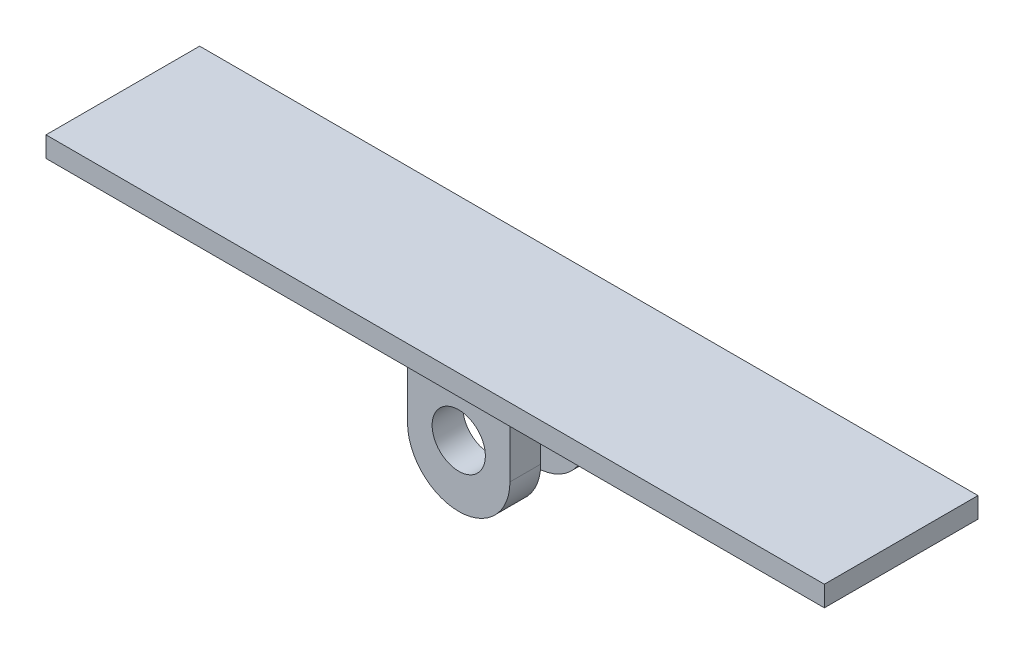
from build123d import *

# Parameters (mm, degrees)
SKETCH1_W           = 2
SKETCH1_H           = 76
BOSS_EXTRUDE1_DEPTH = 15
SKETCH2_W           = 10
SKETCH2_H           = 3
BOSS_EXTRUDE2_DEPTH = 12
SKETCH3_R           = 2.6
CUT_EXTRUDE1_DEPTH  = 12
FILLET1_R           = 5
SCALE1_SCALE        = 0.7


with BuildPart() as part:
    # Sketch1 → Boss-Extrude1 (new body)
    with BuildSketch(Plane(origin=(0, 0, 0), x_dir=(0, 1, 0), z_dir=(0, 0, 1))):
        Rectangle(SKETCH1_W, SKETCH1_H)
    extrude(amount=-BOSS_EXTRUDE1_DEPTH)

    # Sketch2 → Boss-Extrude2 (add)
    with BuildSketch(Plane.XZ.offset(1)):
        with Locations((0, -3.8)):
            Rectangle(SKETCH2_W, SKETCH2_H)
        with Locations((0, -11.3)):
            Rectangle(SKETCH2_W, SKETCH2_H)
    extrude(amount=BOSS_EXTRUDE2_DEPTH)

    # Sketch3 → Cut-Extrude1 (cut)
    with BuildSketch(Plane.XY.offset(-2.3)):
        with Locations((0, -7)):
            Circle(SKETCH3_R)
    extrude(amount=-CUT_EXTRUDE1_DEPTH, mode=Mode.SUBTRACT)

    # Fillet1
    fillet1_edges = [part.edges().sort_by_distance(p)[0] for p in [
        (-5, -13, -11.3),
        (5, -13, -11.3),
        (5, -13, -3.8),
        (-5, -13, -3.8),
    ]]
    fillet(fillet1_edges, radius=FILLET1_R - 0.0001)  # a hair under: the kernel refuses the full size


with BuildPart() as part_1:
    # Scale1: scaled about (0, -1.204695158, -7.509404587)
    add(part.part.scale(SCALE1_SCALE).moved(Location((0, -0.361408547, -2.252821376))))


solid = part_1.part
